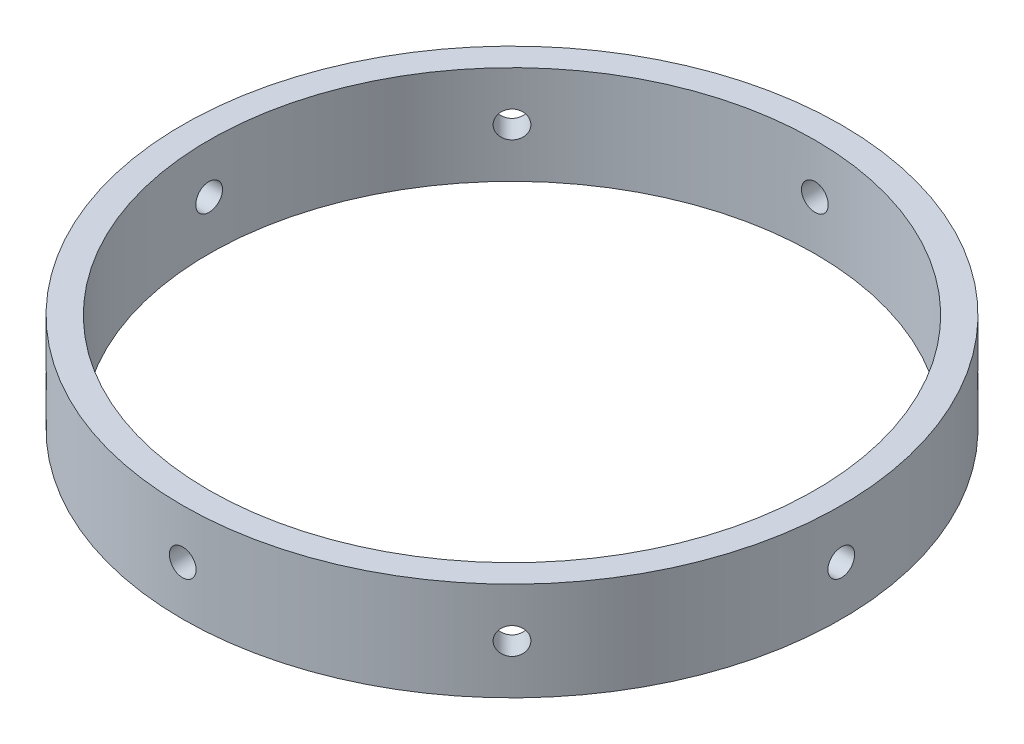
from build123d import *

# Parameters (mm, degrees)
SKETCH3_R           = 46.85
SKETCH3_R_2         = 43.1
BOSS_EXTRUDE1_DEPTH = 14
CUT_EXTRUDE1_REACH  = 107.691
SKETCH5_R           = 1.9
CIRPATTERN1_COUNT   = 8


with BuildPart() as part:
    # Sketch3 → Boss-Extrude1 (new body)
    with BuildSketch(Plane(origin=(0, 0, 0), x_dir=(1, 0, 0), z_dir=(0, 1, 0))):
        Circle(SKETCH3_R)
        Circle(SKETCH3_R_2, mode=Mode.SUBTRACT)
    extrude(amount=BOSS_EXTRUDE1_DEPTH)

    # Sketch5 → Cut-Extrude1 (cut, up to next)
    with BuildSketch(Plane(origin=(46.85, 0, 0), x_dir=(0, 0, -1), z_dir=(1, 0, 0)), mode=Mode.PRIVATE) as cut_extrude1_sk1:
        with Locations((0, 7)):
            Circle(SKETCH5_R)
    cut_extrude1_tool1 = extrude(cut_extrude1_sk1.sketch, amount=-CUT_EXTRUDE1_REACH, mode=Mode.PRIVATE) & part.part
    cut_extrude1 = cut_extrude1_tool1.solids().sort_by_distance((46.85, 7, 0))[0]
    add(cut_extrude1, mode=Mode.SUBTRACT)

    # CirPattern1: Cut-Extrude1 ×8 about axis
    cirpattern1_axis = Axis((0, 14, 0), (0, -1, 0))
    for i in range(1, CIRPATTERN1_COUNT):
        add(cut_extrude1.rotate(cirpattern1_axis, i * 360 / CIRPATTERN1_COUNT), mode=Mode.SUBTRACT)


solid = part.part
